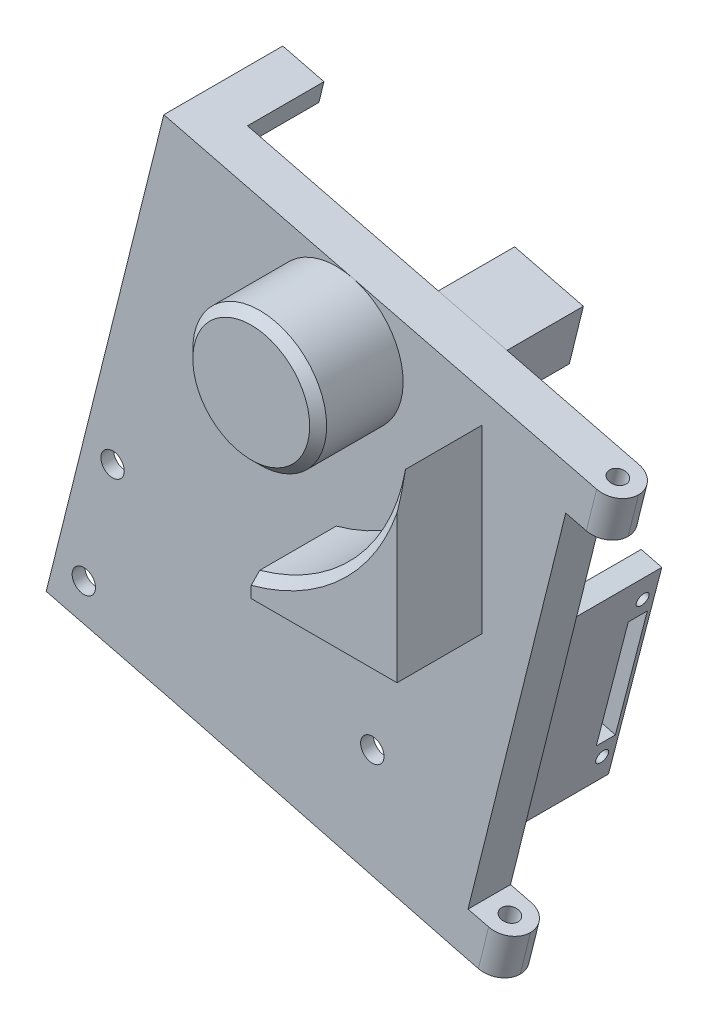
from build123d import *

# Parameters (mm, degrees)
SKETCH_1_R               = 15.75
EXTRUDE_1_DEPTH          = 20
EXTRUDE_1_2_DEPTH        = 20
EXTRUDE_5_DEPTH          = 10
CHAMFER_3_SIZE           = 2
SKETCH_18_W              = 10
SKETCH_18_H              = 10
EXTRUDE_6_DEPTH          = 10
CUT_EXTRUDE_1_DEPTH      = 148.860951012
CUT_EXTRUDE_1_DEPTH_BACK = 148.860951012
SKETCH_19_R              = 2
FILLET_2_R               = 5
EXTRUDE_7_DEPTH          = 10
CUT_EXTRUDE_2_DEPTH      = 7
SKETCH_23_R              = 2.75
CUT_EXTRUDE_3_DEPTH      = 7
EXTRUDE_9_DEPTH          = 18
FILLET_3_R               = 2.5
SKETCH_28_W              = 5
SKETCH_28_H              = 40
EXTRUDE_10_DEPTH         = 50
SKETCH_29_R              = 1.5
SKETCH_29_W              = 30
SKETCH_29_H              = 4.494622667
CUT_EXTRUDE_4_DEPTH      = 50


with BuildPart() as part:
    # 스케치1 → 보스-돌출1 (new body)
    with BuildSketch(Plane(origin=(0, 0, 0), x_dir=(0, 1, 0), z_dir=(0, 0, 1))):
        with Locations(Location((0, 0, 0), (0, 0, 270))):
            Circle(SKETCH_1_R)
    extrude(amount=EXTRUDE_1_DEPTH)



with BuildPart() as body_2:
    # 스케치1 → Extrude 1 2 (new body)
    with BuildSketch(Plane(origin=(0, 0, 0), x_dir=(0, 1, 0), z_dir=(0, 0, 1))):
        with BuildLine():
            ThreePointArc((0.501055918, -34.316325355), (-23.297606239, -22.583389768), (-37.227021319, 0))
            Line((-37.227021319, 0), (-42, 0))
            Line((-42, 0), (-42, -34.316325355))
            Line((-42, -34.316325355), (0.501055918, -34.316325355))
        make_face()
    extrude(amount=EXTRUDE_1_2_DEPTH)


with BuildPart() as part_1:
    add(part.part)

    add(body_2.part)  # 보스-돌출5 merges body 2
    # 스케치17 → 보스-돌출5 (add)
    with BuildSketch(Plane(origin=(0, 0, 0), x_dir=(-1, 0, 0), z_dir=(0, 0, -1))):
        Polygon((-56.448813006, 2.157894853), (-37.030930328, -75.722978764), (-28.611757259, -109.490437583), (39.152120893, -91.926923446), (30.889770512, -58.788446072), (11.471887833, 19.092427545), align=None)
    extrude(amount=EXTRUDE_5_DEPTH)

    # 모따기3
    chamfer_3_edges = [part_1.edges().sort_by_distance(p)[0] for p in [
        (22.583389768, -23.297606239, 20),
        (-15.75, 0, 20),
    ]]
    chamfer(chamfer_3_edges, length=CHAMFER_3_SIZE)

    # 스케치18 → 보스-돌출6 (add)
    with BuildSketch(Plane(origin=(52.63854315, -13.124262836, 0), x_dir=(0.24192189559966906, 0.9702957262759961, 0), z_dir=(0.9702957262759961, -0.24192189559966906, 0))):
        with Locations((-94.316293102, -5)):
            Rectangle(SKETCH_18_W, SKETCH_18_H)
        with Locations((10.75, -5)):
            Rectangle(SKETCH_18_W, SKETCH_18_H)
    extrude(amount=EXTRUDE_6_DEPTH)

    # 스케치19 → 컷-돌출1 (cut, two sides: drawn at the far end of the back side and taken through both)
    with BuildSketch(Plane(origin=(-24.026785891, -96.366174746, 0), x_dir=(0.9702957262759961, -0.24192189559966903, 0), z_dir=(-0.24192189559966903, -0.9702957262759961, 0)).offset(-CUT_EXTRUDE_1_DEPTH_BACK)):
        with Locations((59.25, -5)):
            Circle(SKETCH_19_R)
    extrude(amount=CUT_EXTRUDE_1_DEPTH + CUT_EXTRUDE_1_DEPTH_BACK, mode=Mode.SUBTRACT)

    # 필렛2
    fillet_2_edges = [part_1.edges().sort_by_distance(p)[0] for p in [
        (64.942160791, -5.112802735, -10),
        (64.942160791, -5.112802735, 0),
        (39.524324, -107.058177907, -10),
        (39.524324, -107.058177907, 0),
    ]]
    fillet(fillet_2_edges, radius=FILLET_2_R - 0.0001)  # a hair under: the kernel refuses the full size

    # 스케치21 → 보스-돌출7 (add)
    with BuildSketch(Plane(origin=(0, 0, -10), x_dir=(1, 0, 0), z_dir=(0, 0, -1))):
        Polygon((-11.471887833, -19.092427545), (-39.152120893, 91.926923446), (-68.260992681, 84.669266578), (-40.580759621, -26.350084413), align=None)
    extrude(amount=-EXTRUDE_7_DEPTH)

    # 스케치22 → 컷-돌출2 (cut)
    with BuildSketch(Plane(origin=(0, 0, -10), x_dir=(1, 0, 0), z_dir=(0, 0, -1))):
        Polygon((-68.260992681, 84.669266578), (-57.374507379, 41.005958895), (20.249150723, 60.359710543), (9.362665421, 104.023018226), (4.374510381, 124.029415356), (-73.249147721, 104.675663708), align=None)
    extrude(amount=-CUT_EXTRUDE_2_DEPTH, mode=Mode.SUBTRACT)

    # 스케치23 → 컷-돌출3 (cut)
    with BuildSketch(Plane(origin=(0, 0, -3), x_dir=(1, 0, 0), z_dir=(0, 0, -1))):
        with Locations(Location((8.49768178, 78.557319663, 0), (0, 0, 180))):
            Circle(SKETCH_23_R)
        with Locations(Location((-52.638773407, 50.946925838, 0), (0, 0, 180))):
            Circle(SKETCH_23_R)
        with Locations(Location((-59.412586484, 78.115206174, 0), (0, 0, 180))):
            Circle(SKETCH_23_R)
    extrude(amount=-CUT_EXTRUDE_3_DEPTH, mode=Mode.SUBTRACT)

    # 스케치27 → 보스-돌출9 (add)
    with BuildSketch(Plane(origin=(0, 0, -10), x_dir=(1, 0, 0), z_dir=(0, 0, -1))):
        Polygon((-42.999978577, -16.64712715), (-38.148499946, -15.437517672), (-36.938890468, -20.288996303), (-32.087411837, -19.079386825), (-30.877802359, -23.930865457), (-40.580759621, -26.350084413), align=None)
        Polygon((-47.341531979, 21.433719927), (-42.490053347, 22.643329405), (-43.699662825, 27.494808036), (-53.402620088, 25.07558908), (-50.983401132, 15.372631817), (-46.131922501, 16.582241295), align=None)
        Polygon((1.221618851, 38.694941482), (17.42896793, 42.735887459), (20.908348254, 28.780855193), (16.056869623, 27.571245715), (13.787098777, 36.674799349), (2.431228329, 33.84346285), align=None)
        Polygon((26.870688445, 4.724510909), (22.019209813, 3.514901431), (24.148746591, -5.026204076), (12.792876144, -7.857540575), (14.002485622, -12.709019206), (30.175814481, -8.676555422), align=None)
    extrude(amount=EXTRUDE_9_DEPTH)

    # 필렛3
    fillet_3_edges = [part_1.edges().sort_by_distance(p)[0] for p in [
        (-36.938890468, 20.288996303, -19),
        (13.787098777, -36.674799349, -19),
        (24.148746591, 5.026204076, -19),
        (-47.341531979, -21.433719927, -19),
    ]]
    fillet(fillet_3_edges, radius=FILLET_3_R)

    # 스케치28 → 보스-돌출10 (add)
    with BuildSketch(Plane(origin=(-24.791009663, -95.649136326, 0), x_dir=(0.9680138959056901, -0.25089658693072686, 0), z_dir=(-0.25089658693072686, -0.9680138959056901, 0))):
        with Locations((37.666498149, -30)):
            Rectangle(SKETCH_28_W, SKETCH_28_H)
    extrude(amount=-EXTRUDE_10_DEPTH)

    # 스케치29 → 컷-돌출4 (cut)
    with BuildSketch(Plane(origin=(38.881728358, -10.077637295, 0), x_dir=(0.25089658693072686, 0.9680138959056901, 0), z_dir=(0.9680138959056901, -0.25089658693072686, 0))):
        with Locations((-54.809672806, -47)):
            Circle(SKETCH_29_R)
        with Locations((-92.809672806, -47)):
            Circle(SKETCH_29_R)
        with Locations((-92.809672806, -13)):
            Circle(SKETCH_29_R)
        with Locations((-54.809672806, -13)):
            Circle(SKETCH_29_R)
        with Locations((-73.809672806, -46.863560509)):
            Rectangle(SKETCH_29_W, SKETCH_29_H)
    extrude(amount=-CUT_EXTRUDE_4_DEPTH, mode=Mode.SUBTRACT)


solid = part_1.part
